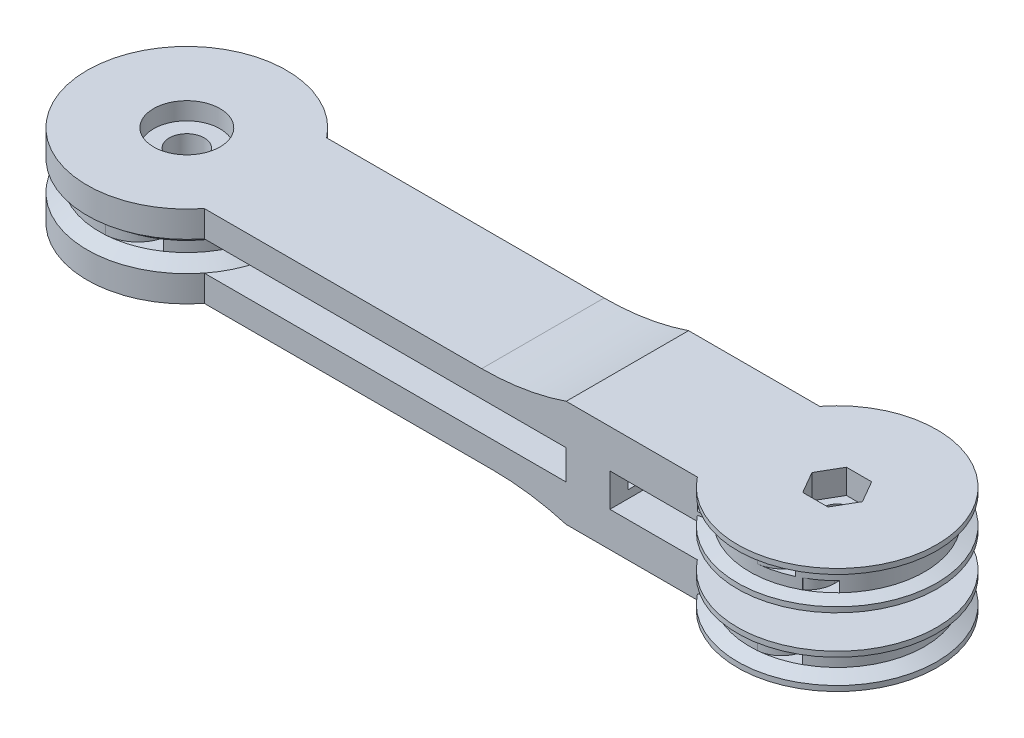
from build123d import *

# Parameters (mm, degrees)
BOSS_EXTRUDE1_START              = 0.85
BOSS_EXTRUDE1_DEPTH              = 1.5
BOSS_EXTRUDE2_START              = 1.7
BOSS_EXTRUDE2_DEPTH              = 1.7
SLOTBLOCK_START                  = -0.1
SKETCH3_W                        = 2.5
SKETCH3_H                        = 7
SLOTBLOCK_DEPTH                  = 1.9
SKETCH4_W                        = 1.1
SKETCH4_H                        = 1.7
SKETCH4_W_2                      = 0.7
SKETCH4_H_2                      = 1
CLIPENTRANCE_DEPTH               = 2
SKETCH4_3_W                      = 0.7
SKETCH4_3_H                      = 1
CABLEEXIT_DEPTH                  = 2.5
SKETCH5_W                        = 1.5
SKETCH5_H                        = 1.7
CLIPLOCKSLOT_DEPTH               = 0.6
SKETCH6_W                        = 0.3
SKETCH6_H                        = 1.7
CLIPLOCKCLEARANCECUT_DEPTH       = 2
BOSS_EXTRUDE6_START              = 0.95
SKETCH1_4_R                      = 5
BOSS_EXTRUDE6_DEPTH              = 2.2
UEP_CABLECLEARANCECUT_START      = -1.2
UEP_CABLECLEARANCECUT_DEPTH      = 1.2
FILLET1_R                        = 15
UEP_CABLESLOT1_DEPTH             = 0.6
UEP_CABLESLOT2_START             = -0.601
UEP_CABLESLOT2_DEPTH             = 0.6
BOSS_EXTRUDE7_START              = -2.95
SKETCH1_5_R                      = 5
BOSS_EXTRUDE7_DEPTH              = 2
LEP_CABLECLEARANCECUT_DEPTH      = 0.3
LEP_CABLECLEARANCECUT_DEPTH_BACK = 0.3
FILLET2_R                        = 15
LEP_CABLESLOT_DEPTH              = 0.3
ELBOWSHAFTBOLTHOLE_REACH         = 45.705
SKETCH13_R                       = 0.8
SKETCH13_3_R                     = 1.55
SKETCH13_3_R_2                   = 0.8
ELBOWSHAFTBOLT_HEADSLOT_DEPTH    = 1
ELBOWSHAFTBOLT_NUTSLOT_DEPTH     = 1.4
BOSS_EXTRUDE3_REACH              = 45.392
SKETCH1_6_R                      = 5
BOSS_EXTRUDE3_DIRECTION_2_REACH  = 45.392
SP_CABLE_CLEARANCECUT_START      = -0.3
SP_CABLE_CLEARANCECUT_DEPTH      = 0.6
SP_CABLESLOT_DEPTH               = 0.6
SKETCH20_R                       = 1
SHOULDERSHAFTBOLTHOLE_DEPTH      = 44.600344035
SKETCH20_3_R                     = 1.9
SKETCH20_3_R_2                   = 1
MAINSLOT_DEPTH                   = 1


# Read off the part's stored shape, not the designer's step: SP_Cable_ClearanceCut
with BuildPart() as part:
    # Sketch1 → Boss-Extrude1 (new body)
    with BuildSketch(Plane(origin=(0, 0, 0), x_dir=(1, 0, 0), z_dir=(0, 1, 0)).offset(BOSS_EXTRUDE1_START)):
        with BuildLine():
            ThreePointArc((5, 0), (4.628907596, -1.890294809), (3.570714214, -3.5))
            Line((3.570714214, -3.5), (25.2, -3.5))
            Line((25.2, -3.5), (25.2, 3.5))
            Line((25.2, 3.5), (3.570714214, 3.5))
            ThreePointArc((3.570714214, 3.5), (4.628907596, 1.890294809), (5, 0))
        make_face()
    boss_extrude1 = extrude(amount=BOSS_EXTRUDE1_DEPTH)

    # Sketch2 → Boss-Extrude2 (add)
    with BuildSketch(Plane.XZ.offset(-0.85).offset(BOSS_EXTRUDE2_START)):
        with BuildLine():
            Line((5, 0), (25.2, 0))
            Line((25.2, 0), (25.2, 0.75))
            Line((25.2, 0.75), (5, 0.75))
            Line((5, 0.75), (4.943429983, 0.75))
            ThreePointArc((4.943429983, 0.75), (4.985837438, 0.376065209), (5, 0))
        make_face()
        with BuildLine():
            Line((25.2, -0.75), (25.2, 0))
            Line((25.2, 0), (5, 0))
            ThreePointArc((5, 0), (4.985837438, -0.376065209), (4.943429983, -0.75))
            Line((4.943429983, -0.75), (5, -0.75))
            Line((5, -0.75), (25.2, -0.75))
        make_face()
    extrude(amount=-BOSS_EXTRUDE2_DEPTH)

    # Mirror2: Boss-Extrude1 across plane
    add(boss_extrude1.mirror(Plane.ZX))

    # Sketch3 → SlotBlock (add)
    with BuildSketch(Plane(origin=(0, -0.85, 0), x_dir=(1, 0, 0), z_dir=(0, 1, 0)).offset(SLOTBLOCK_START)):
        with Locations((26.45, 0)):
            Rectangle(SKETCH3_W, SKETCH3_H)
    extrude(amount=SLOTBLOCK_DEPTH)

    # Sketch4 → ClipEntrance (cut)
    # profile 1 of 2: a face of its own
    with BuildSketch(Plane.ZY.offset(-25.2)):
        with Locations((2.125, 0)):
            Rectangle(SKETCH4_W, SKETCH4_H)
        with Locations((2.125, 0)):
            Rectangle(SKETCH4_W_2, SKETCH4_H_2, mode=Mode.SUBTRACT)
    # profile 2 of 2: a face of its own
    with BuildSketch(Plane.ZY.offset(-25.2)):
        with Locations((2.125, 0)):
            Rectangle(SKETCH4_W_2, SKETCH4_H_2)
    clipentrance = extrude(amount=-CLIPENTRANCE_DEPTH, mode=Mode.SUBTRACT)

    # Sketch4<3> → CableExit (cut)
    with BuildSketch(Plane.ZY.offset(-25.2)):
        with Locations((2.125, 0)):
            Rectangle(SKETCH4_3_W, SKETCH4_3_H)
    cableexit = extrude(amount=-CABLEEXIT_DEPTH, mode=Mode.SUBTRACT)

    # Sketch5 → ClipLockSlot (cut)
    with BuildSketch(Plane(origin=(0, 0, 1.575), x_dir=(-1, 0, 0), z_dir=(0, 0, -1))):
        with Locations((-26.45, 0)):
            Rectangle(SKETCH5_W, SKETCH5_H)
    cliplockslot = extrude(amount=CLIPLOCKSLOT_DEPTH, mode=Mode.SUBTRACT)

    # Sketch6 → ClipLockClearanceCut (cut)
    with BuildSketch(Plane.ZY.offset(-25.2)):
        with Locations((1.425, 0)):
            Rectangle(SKETCH6_W, SKETCH6_H)
    cliplockclearancecut = extrude(amount=-CLIPLOCKCLEARANCECUT_DEPTH, mode=Mode.SUBTRACT)

    # Mirror3: ClipEntrance, CableExit, ClipLockSlot, ClipLockClearanceCut across plane
    add(clipentrance.mirror(Plane.XY), mode=Mode.SUBTRACT)
    add(cableexit.mirror(Plane.XY), mode=Mode.SUBTRACT)
    add(cliplockslot.mirror(Plane.XY), mode=Mode.SUBTRACT)
    add(cliplockclearancecut.mirror(Plane.XY), mode=Mode.SUBTRACT)

    # Sketch1<4> → Boss-Extrude6 (add)
    with BuildSketch(Plane(origin=(0, 0, 0), x_dir=(1, 0, 0), z_dir=(0, 1, 0)).offset(BOSS_EXTRUDE6_START)):
        with BuildLine():
            Line((25.2, 3.5), (25.2, -3.5))
            Line((25.2, -3.5), (33.629285786, -3.5))
            ThreePointArc((33.629285786, -3.5), (32.2, 0), (33.629285786, 3.5))
            Line((33.629285786, 3.5), (25.2, 3.5))
        make_face()
        with Locations((37.2, 0)):
            Circle(SKETCH1_4_R)
    extrude(amount=BOSS_EXTRUDE6_DEPTH)

    # Sketch7 → Revolve1 (revolve)
    with BuildSketch(Plane.XY):
        Polygon((42.2, 3.15), (42.2, 2.65), (42.9, 2.85), (42.9, 3.15), align=None)
        Polygon((42.2, 1.45), (42.2, 0.95), (42.9, 0.95), (42.9, 1.25), align=None)
    revolve(axis=Axis((37.2, 3.15, 0), (0, -1, 0)))

    # Sketch8 → UEP_CableClearanceCut (cut)
    with BuildSketch(Plane(origin=(0, 1.45, 0), x_dir=(-1, 0, 0), z_dir=(0, -1, 0)).offset(UEP_CABLECLEARANCECUT_START)):
        with BuildLine():
            Line((-32.701111248, 3.5), (-33.629285786, 3.5))
            ThreePointArc((-33.629285786, 3.5), (-32.2, 0), (-33.629285786, -3.5))
            Line((-33.629285786, -3.5), (-32.701111248, -3.5))
            ThreePointArc((-32.701111248, -3.5), (-31.5, 0), (-32.701111248, 3.5))
        make_face()
        with BuildLine():
            Line((-27.701111248, 3.5), (-32.701111248, 3.5))
            ThreePointArc((-32.701111248, 3.5), (-31.501226079, 0.118219293), (-32.559831346, -3.310413095))
            Line((-32.559831346, -3.310413095), (-27.701111248, 3.5))
        make_face()
    extrude(amount=UEP_CABLECLEARANCECUT_DEPTH, mode=Mode.SUBTRACT)

    # Fillet1
    # the kernel refuses this fillet: 15 mm, written as the material it adds along each edge
    with BuildSketch(Plane(origin=(25.2, 2.35, 3.5), x_dir=(-1, 0, 0), z_dir=(0, 0, -1))) as fillet1_piece_1:
        with BuildLine():
            CenterArc((4.833218389, 15), FILLET1_R, 251.203094965, 18.796905035)
            Line((0, 0.8), (-0.096664368, 0.516))
            ThreePointArc((-0.096664368, 0.516), (-0.3, 0.4), (-0.3, 0))
            Line((-0.3, 0), (0, -0.3))
            Line((0, -0.3), (4.833218389, -0.3))
            Line((4.833218389, -0.3), (4.833218389, 0))
        make_face()
    extrude(amount=7)

    # Sketch9 → UEP_CableSlot1 (cut)
    with BuildSketch(Plane(origin=(0, 1.45, 0), x_dir=(-1, 0, 0), z_dir=(0, -1, 0))):
        with BuildLine():
            ThreePointArc((-40.8, -3.469870315), (-40.234794934, -3.973665777), (-39.6, -4.38634244))
            Line((-39.6, -4.38634244), (-39.6, -4.36227766))
            ThreePointArc((-39.6, -4.36227766), (-40.041640786, -3.833098053), (-40.2, -3.16227766))
            Line((-40.2, -3.16227766), (-40.2, 3.16227766))
            ThreePointArc((-40.2, 3.16227766), (-40.041640786, 3.833098053), (-39.6, 4.36227766))
            Line((-39.6, 4.36227766), (-39.6, 4.38634244))
            ThreePointArc((-39.6, 4.38634244), (-40.234794934, 3.973665777), (-40.8, 3.469870315))
            Line((-40.8, 3.469870315), (-40.8, -3.469870315))
        make_face()
    extrude(amount=-UEP_CABLESLOT1_DEPTH, mode=Mode.SUBTRACT)

    # Sketch9<4> → UEP_CableSlot2 (cut)
    with BuildSketch(Plane(origin=(0, 1.45, 0), x_dir=(-1, 0, 0), z_dir=(0, -1, 0)).offset(UEP_CABLESLOT2_START)):
        with BuildLine():
            ThreePointArc((-37.628571429, -4.981598793), (-38.605182596, -4.501304261), (-39, -3.487119155))
            Line((-39, -3.487119155), (-39, 3.487119155))
            ThreePointArc((-39, 3.487119155), (-38.605182596, 4.501304261), (-37.628571429, 4.981598793))
            ThreePointArc((-37.628571429, 4.981598793), (-38.50648344, 4.826292679), (-39.342857143, 4.517539515))
            ThreePointArc((-39.342857143, 4.517539515), (-39.475324836, 4.446361535), (-39.6, 4.36227766))
            Line((-39.6, 4.36227766), (-39.6, -4.36227766))
            ThreePointArc((-39.6, -4.36227766), (-39.475324836, -4.446361535), (-39.342857143, -4.517539515))
            ThreePointArc((-39.342857143, -4.517539515), (-38.50648344, -4.826292679), (-37.628571429, -4.981598793))
        make_face()
    extrude(amount=-UEP_CABLESLOT2_DEPTH, mode=Mode.SUBTRACT)

    # Sketch1<5> → Boss-Extrude7 (add)
    with BuildSketch(Plane(origin=(0, 0, 0), x_dir=(1, 0, 0), z_dir=(0, 1, 0)).offset(BOSS_EXTRUDE7_START)):
        with BuildLine():
            Line((25.2, 3.5), (25.2, -3.5))
            Line((25.2, -3.5), (33.629285786, -3.5))
            ThreePointArc((33.629285786, -3.5), (32.2, 0), (33.629285786, 3.5))
            Line((33.629285786, 3.5), (25.2, 3.5))
        make_face()
        with Locations(Location((37.2, 0, 0), (0, 0, 135.572995999))):
            Circle(SKETCH1_5_R)
    extrude(amount=BOSS_EXTRUDE7_DEPTH)

    # Sketch10 → Revolve2 (revolve)
    with BuildSketch(Plane.XY):
        Polygon((42.2, -0.95), (42.2, -1.65), (42.9, -1.25), (42.9, -0.95), align=None)
        Polygon((42.2, -2.25), (42.2, -2.95), (42.9, -2.95), (42.9, -2.65), align=None)
    revolve(axis=Axis((37.2, -2.95, 0), (0, 1, 0)))

    # Sketch11 → LEP_CableClearanceCut (cut, two sides: drawn at the far end of the back side and taken through both)
    with BuildSketch(Plane(origin=(0, -1.95, 0), x_dir=(1, 0, 0), z_dir=(0, 1, 0)).offset(-LEP_CABLECLEARANCECUT_DEPTH_BACK)):
        with BuildLine():
            Line((27.701111248, 3.5), (32.559831346, -3.310413095))
            ThreePointArc((32.559831346, -3.310413095), (31.501226079, 0.118219293), (32.701111248, 3.5))
            Line((32.701111248, 3.5), (27.701111248, 3.5))
        make_face()
        with BuildLine():
            ThreePointArc((33.629285786, 3.5), (32.2, 0), (33.629285786, -3.5))
            Line((33.629285786, -3.5), (32.701111248, -3.5))
            ThreePointArc((32.701111248, -3.5), (31.5, 0), (32.701111248, 3.5))
            Line((32.701111248, 3.5), (33.629285786, 3.5))
        make_face()
    extrude(amount=LEP_CABLECLEARANCECUT_DEPTH + LEP_CABLECLEARANCECUT_DEPTH_BACK, mode=Mode.SUBTRACT)

    # Fillet2
    # the kernel refuses this fillet: 15 mm, written as the material it adds along each edge
    with BuildSketch(Plane(origin=(25.2, -2.35, 3.5), x_dir=(0, -1, 0), z_dir=(0, 0, -1))) as fillet2_piece_1:
        with BuildLine():
            CenterArc((15, 4.2), FILLET2_R, 180, 16.260204708)
            Line((0, 4.2), (-0.3, 4.2))
            Line((-0.3, 4.2), (-0.3, 0))
            Line((-0.3, 0), (0, -0.3))
            ThreePointArc((0, -0.3), (0.3, -0.3), (0.312, -0.084))
            Line((0.312, -0.084), (0.6, 0))
        make_face()
    extrude(amount=7)

    # Sketch12 → LEP_CableSlot (cut, symmetric)
    with BuildSketch(Plane(origin=(0, -1.95, 0), x_dir=(1, 0, 0), z_dir=(0, 1, 0))):
        with BuildLine():
            ThreePointArc((37.628571429, -4.981598793), (38.64526351, -4.786565928), (39.6, -4.38634244))
            Line((39.6, -4.38634244), (39.6, 4.38634244))
            ThreePointArc((39.6, 4.38634244), (38.64526351, 4.786565928), (37.628571429, 4.981598793))
            ThreePointArc((37.628571429, 4.981598793), (38.605182596, 4.501304261), (39, 3.487119155))
            Line((39, 3.487119155), (39, -3.487119155))
            ThreePointArc((39, -3.487119155), (38.605182596, -4.501304261), (37.628571429, -4.981598793))
        make_face()
    extrude(amount=LEP_CABLESLOT_DEPTH, both=True, mode=Mode.SUBTRACT)

    # ElbowShaftBoltHole: up to this face of the body (flat: up to its plane)
    elbowshaftbolthole_end = Plane(part.part.faces().sort_by_distance((34.481857248, 3.15, 0))[0])
    # Sketch13 → ElbowShaftBoltHole (cut, up to the picked face)
    with BuildSketch(Plane.XZ.offset(2.95), mode=Mode.PRIVATE) as elbowshaftbolthole_sk1:
        with Locations(Location((37.2, 0, 0), (0, 0, 270))):
            Circle(SKETCH13_R)
    elbowshaftbolthole_tool1 = split(extrude(elbowshaftbolthole_sk1.sketch, amount=-ELBOWSHAFTBOLTHOLE_REACH, mode=Mode.PRIVATE), bisect_by=elbowshaftbolthole_end, keep=Keep.BOTH, mode=Mode.PRIVATE)
    add(elbowshaftbolthole_tool1.solids().sort_by(Axis((37.2, -2.95, 0), (0, 1, 0)))[0], mode=Mode.SUBTRACT)

    # Sketch13<3> → ElbowShaftBolt_HeadSlot (cut)
    with BuildSketch(Plane.XZ.offset(2.95)):
        with Locations(Location((37.2, 0, 0), (0, 0, 270))):
            Circle(SKETCH13_3_R)
        with Locations(Location((37.2, 0, 0), (0, 0, 270))):
            Circle(SKETCH13_3_R_2, mode=Mode.SUBTRACT)
    extrude(amount=-ELBOWSHAFTBOLT_HEADSLOT_DEPTH, mode=Mode.SUBTRACT)

    # Sketch15 → ElbowShaftBolt_NutSlot (cut)
    with BuildSketch(Plane(origin=(0, 3.15, 0), x_dir=(1, 0, 0), z_dir=(0, 1, 0))):
        Polygon((37.921687836, 1.25), (36.478312164, 1.25), (35.756624327, 0), (36.478312164, -1.25), (37.921687836, -1.25), (38.643375673, 0), align=None)
    extrude(amount=-ELBOWSHAFTBOLT_NUTSLOT_DEPTH, mode=Mode.SUBTRACT)

    # Boss-Extrude3: up to this face of the body (flat: up to its plane)
    boss_extrude3_end = Plane(part.part.faces().sort_by_distance((12.45526962, 2.35, 0))[0])
    # Sketch1<6> → Boss-Extrude3 (add, up to the picked face)
    with BuildSketch(Plane(origin=(0, 0, 0), x_dir=(1, 0, 0), z_dir=(0, 1, 0)), mode=Mode.PRIVATE) as boss_extrude3_sk1:
        Circle(SKETCH1_6_R)
    boss_extrude3_tool1 = split(extrude(boss_extrude3_sk1.sketch, amount=BOSS_EXTRUDE3_REACH, mode=Mode.PRIVATE), bisect_by=boss_extrude3_end, keep=Keep.BOTH, mode=Mode.PRIVATE)
    add(boss_extrude3_tool1.solids().sort_by(Axis((0, 0, 0), (0, 1, 0)))[0])

    # Boss-Extrude3 direction 2: up to this face of the body (flat: up to its plane)
    boss_extrude3_direction_2_end = Plane(part.part.faces().sort_by_distance((12.772088207, -2.35, 0))[0])
    # Sketch1<6> → Boss-Extrude3 direction 2 (add, up to the picked face)
    with BuildSketch(Plane(origin=(0, 0, 0), x_dir=(1, 0, 0), z_dir=(0, 1, 0)), mode=Mode.PRIVATE) as boss_extrude3_direction_2_sk1:
        Circle(SKETCH1_6_R)
    boss_extrude3_direction_2_tool1 = split(extrude(boss_extrude3_direction_2_sk1.sketch, amount=-BOSS_EXTRUDE3_DIRECTION_2_REACH, mode=Mode.PRIVATE), bisect_by=boss_extrude3_direction_2_end, keep=Keep.BOTH, mode=Mode.PRIVATE)
    add(boss_extrude3_direction_2_tool1.solids().sort_by(Axis((0, 0, 0), (0, -1, 0)))[0])

    # Sketch16 → Revolve3 (revolve)
    with BuildSketch(Plane.XY):
        Polygon((-5, 0.3), (-5, 2.35), (-5.7, 2.35), (-5.7, 0.85), align=None)
        Polygon((-5, -2.35), (-5, -0.3), (-5.7, -0.85), (-5.7, -2.35), align=None)
    revolve(axis=Axis((0, 16.492135624, 0), (0, -1, 0)))

    # SP_Cable_ClearanceCut outline → SP_Cable_ClearanceCut (cut)
    with BuildSketch(Plane(origin=(0, 0, 0), x_dir=(1, 0, 0), z_dir=(0, 1, 0)).offset(SP_CABLE_CLEARANCECUT_START)):
        with BuildLine():
            Line((5.9, -0.75), (5.9, 0.75))
            Line((5.9, 0.75), (4.943429983, 0.75))
            ThreePointArc((4.943429983, 0.75), (5, 0), (4.943429983, -0.75))
            Line((4.943429983, -0.75), (5.9, -0.75))
        make_face()
    extrude(amount=SP_CABLE_CLEARANCECUT_DEPTH, mode=Mode.SUBTRACT)

    # Sketch23 → SP_CableSlot (cut)
    with BuildSketch(Plane(origin=(0, -0.3, 0), x_dir=(1, 0, 0), z_dir=(0, 1, 0))):
        with BuildLine():
            ThreePointArc((0.333333333, 4.988876516), (1.660593487, 4.359586012), (2.2, 2.993325909))
            Line((2.2, 2.993325909), (2.2, -2.993325909))
            ThreePointArc((2.2, -2.993325909), (1.660593487, -4.359586012), (0.333333333, -4.988876516))
            ThreePointArc((0.333333333, -4.988876516), (1.622821121, -4.729318303), (2.8, -4.142463035))
            Line((2.8, -4.142463035), (2.8, 4.142463035))
            ThreePointArc((2.8, 4.142463035), (1.622821121, 4.729318303), (0.333333333, 4.988876516))
        make_face()
    extrude(amount=SP_CABLESLOT_DEPTH, mode=Mode.SUBTRACT)

    # Sketch20 → ShoulderShaftBoltHole (cut, through all)
    with BuildSketch(Plane(origin=(0, 2.35, 0), x_dir=(1, 0, 0), z_dir=(0, 1, 0))):
        with Locations(Location((0, 0, 0), (0, 0, 270))):
            Circle(SKETCH20_R)
    extrude(amount=-SHOULDERSHAFTBOLTHOLE_DEPTH, mode=Mode.SUBTRACT)

    # Sketch20<3> → MainSlot (cut)
    with BuildSketch(Plane(origin=(0, 2.35, 0), x_dir=(1, 0, 0), z_dir=(0, 1, 0))):
        with Locations(Location((0, 0, 0), (0, 0, 270))):
            Circle(SKETCH20_3_R)
        with Locations(Location((0, 0, 0), (0, 0, 270))):
            Circle(SKETCH20_3_R_2, mode=Mode.SUBTRACT)
    extrude(amount=-MAINSLOT_DEPTH, mode=Mode.SUBTRACT)


solid = part.part
